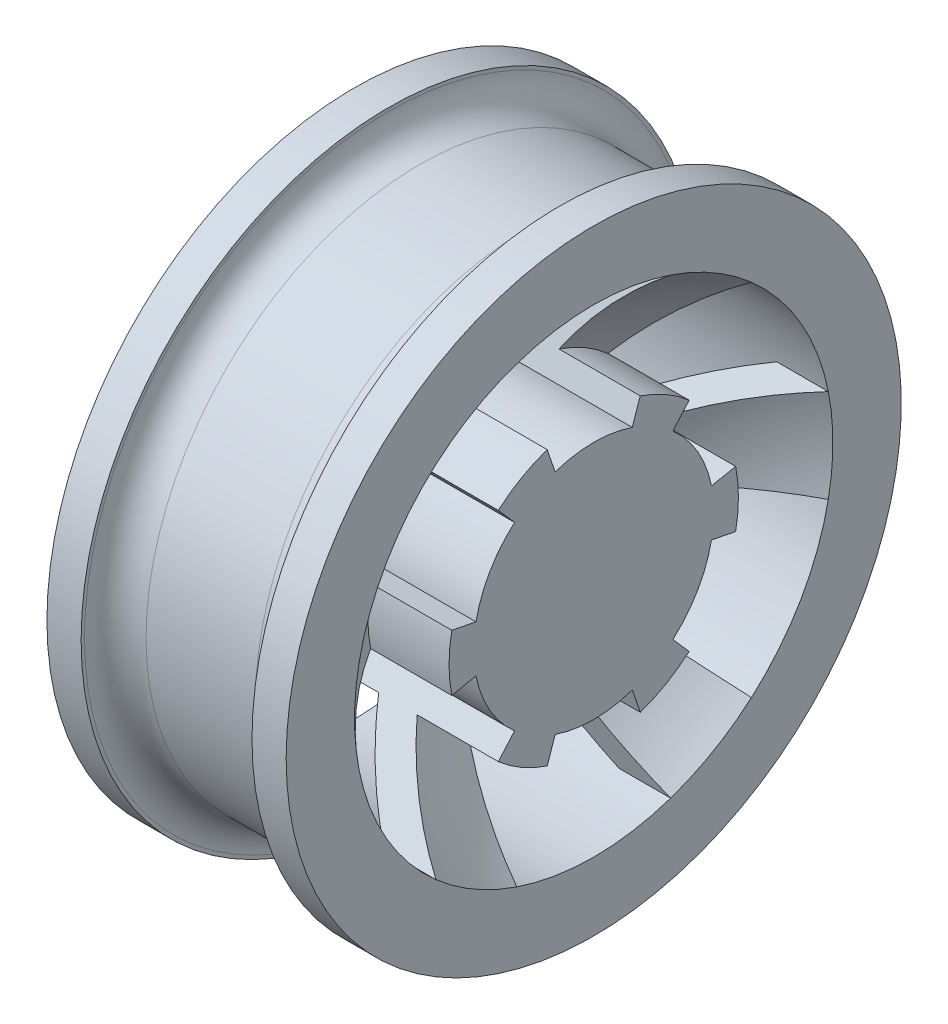
from build123d import *

# Parameters (mm, degrees)
REVOLVE2_OUTLINE_W  = 25.39999999999995
REVOLVE2_OUTLINE_H  = 38.407758663
SKETCH3_R           = 107.54843304644665
SKETCH3_R_2         = 12.700000000000003
BOSS_EXTRUDE1_DEPTH = 177.79999999999998
BOSS_EXTRUDE2_START = -50.8
SKETCH4_R           = 107.54843304644665
BOSS_EXTRUDE2_DEPTH = 50.8
CUT_EXTRUDE1_START  = -508
CUT_EXTRUDE1_DEPTH  = 508
CIRPATTERN1_COUNT   = 6


# Read off the part's stored shape, not the designer's step: Revolve2
with BuildPart() as part:
    # Revolve2 outline → Revolve2 (revolve)
    with BuildSketch(Plane.YX):
        with BuildLine():
            add(Edge.make_bspline(
                [(12.7, 0), (65.56394076942757, 5.423140195743021), (107.548433046, 28.563700108)],
                knots=[0, 0, 0, 0.5115772122825497, 0.5115772122825497, 0.5115772122825497], degree=2))
            Line((12.7, 0), (107.548433046, 0))
            Line((107.548433046, 0), (107.548433046, 28.563700108))
        make_face()
        with BuildLine():
            add(Edge.make_bspline(
                [(107.548433046, 28.563700108), (124.74480096527253, 38.04180882229545), (140.116002229, 50.492241337)],
                knots=[0.5115772122825497, 0.5115772122825497, 0.5115772122825497, 0.7211133882490103, 0.7211133882490103, 0.7211133882490103], degree=2))
            Line((107.548433046, 28.563700108), (107.548433046, 0))
            add(Edge.make_bspline(
                [(177.8, 50.492241337), (174.25870908441857, 46.88747078495737), (156.1505738072, 29.8029081407884), (124.48137705008449, 8.138883125204057), (107.548433046, 0)],
                knots=[0.1400938920026617, 0.1400938920026617, 0.1400938920026617, 0.1875, 0.375, 0.5544007278163002, 0.5544007278163002, 0.5544007278163002], degree=2))
            Line((177.8, 50.492241337), (140.116002229, 50.492241337))
        make_face()
        with BuildLine():
            add(Edge.make_bspline(
                [(140.116002229, 50.492241337), (160.57462814001852, 67.06340821472577), (177.8, 88.9)],
                knots=[0.7211133882490103, 0.7211133882490103, 0.7211133882490103, 1, 1, 1], degree=2))
            Line((140.116002229, 50.492241337), (177.8, 50.492241337))
            Line((177.8, 50.492241337), (177.8, 88.9))
        make_face()
        Polygon((203.2, 50.492241337), (177.8, 50.492241337), (177.8, 0), (203.2, 0), (203.2, 40.64), align=None)
        with Locations((190.5, 69.6961206685)):
            Rectangle(REVOLVE2_OUTLINE_W, REVOLVE2_OUTLINE_H)
        Polygon((203.2, 0), (177.8, 0), (177.8, -88.9), (203.2, -88.9), (203.2, -40.64), align=None)
        with BuildLine():
            Line((205.432034985, 50.492241337), (203.2, 50.492241337))
            Line((203.2, 50.492241337), (203.2, 40.64))
            ThreePointArc((203.2, 40.64), (203.76499069, 45.690956334), (205.432034985, 50.492241337))
        make_face()
        with BuildLine():
            Line((203.2, 88.9), (203.2, 50.492241337))
            Line((203.2, 50.492241337), (205.432034985, 50.492241337))
            ThreePointArc((205.432034985, 50.492241337), (213.866613206, 59.976517745), (226.06, 63.5))
            Line((226.06, 63.5), (228.6, 63.5))
            Line((228.6, 63.5), (228.6, 88.9))
            Line((228.6, 88.9), (203.2, 88.9))
        make_face()
        with BuildLine():
            Line((203.2, -40.64), (203.2, -88.9))
            Line((203.2, -88.9), (228.6, -88.9))
            Line((228.6, -88.9), (228.6, -63.5))
            Line((228.6, -63.5), (226.06, -63.5))
            ThreePointArc((226.06, -63.5), (209.895538982, -56.804461018), (203.2, -40.64))
        make_face()
    revolve(axis=Axis((0, 0, 0), (1, 0, 0)))

    # Sketch3 → Boss-Extrude1 (add)
    with BuildSketch(Plane.ZY.offset(88.89999999999999)):
        Circle(SKETCH3_R)
        Circle(SKETCH3_R_2, mode=Mode.SUBTRACT)
    extrude(amount=-BOSS_EXTRUDE1_DEPTH)

    # Sketch4 → Boss-Extrude2 (add)
    with BuildSketch(Plane(origin=(88.89999999999999, 0, 0), x_dir=(0, 0, -1), z_dir=(1, 0, 0)).offset(BOSS_EXTRUDE2_START)):
        with Locations(Location((0, 0, 0), (0, 0, 180))):
            Circle(SKETCH4_R)
    extrude(amount=BOSS_EXTRUDE2_DEPTH)

    # Sketch5 → Cut-Extrude1 (cut)
    with BuildSketch(Plane(origin=(88.89999999999999, 0, 0), x_dir=(0, 0, -1), z_dir=(1, 0, 0)).offset(CUT_EXTRUDE1_START)):
        with BuildLine():
            Line((-28.680637108892512, 84.49362590578919), (-57.15, 168.36483451124818))
            ThreePointArc((-57.15, 168.36483451124818), (1.089e-14, 177.79999999999995), (57.15, 168.36483451124818))
            Line((57.15, 168.36483451124818), (28.680637108892512, 84.49362590578919))
            ThreePointArc((28.680637108892512, 84.49362590578919), (5.46e-15, 89.22864878322115), (-28.680637108892512, 84.49362590578919))
        make_face()
    cut_extrude1 = extrude(amount=CUT_EXTRUDE1_DEPTH, mode=Mode.SUBTRACT)

    # CirPattern1: Cut-Extrude1 ×6 about axis
    cirpattern1_axis = Axis((0, 2.4e-16, 1.8e-16), (1, 0, 0))
    for i in range(1, CIRPATTERN1_COUNT):
        add(cut_extrude1.rotate(cirpattern1_axis, i * 360 / CIRPATTERN1_COUNT), mode=Mode.SUBTRACT)


solid = part.part
